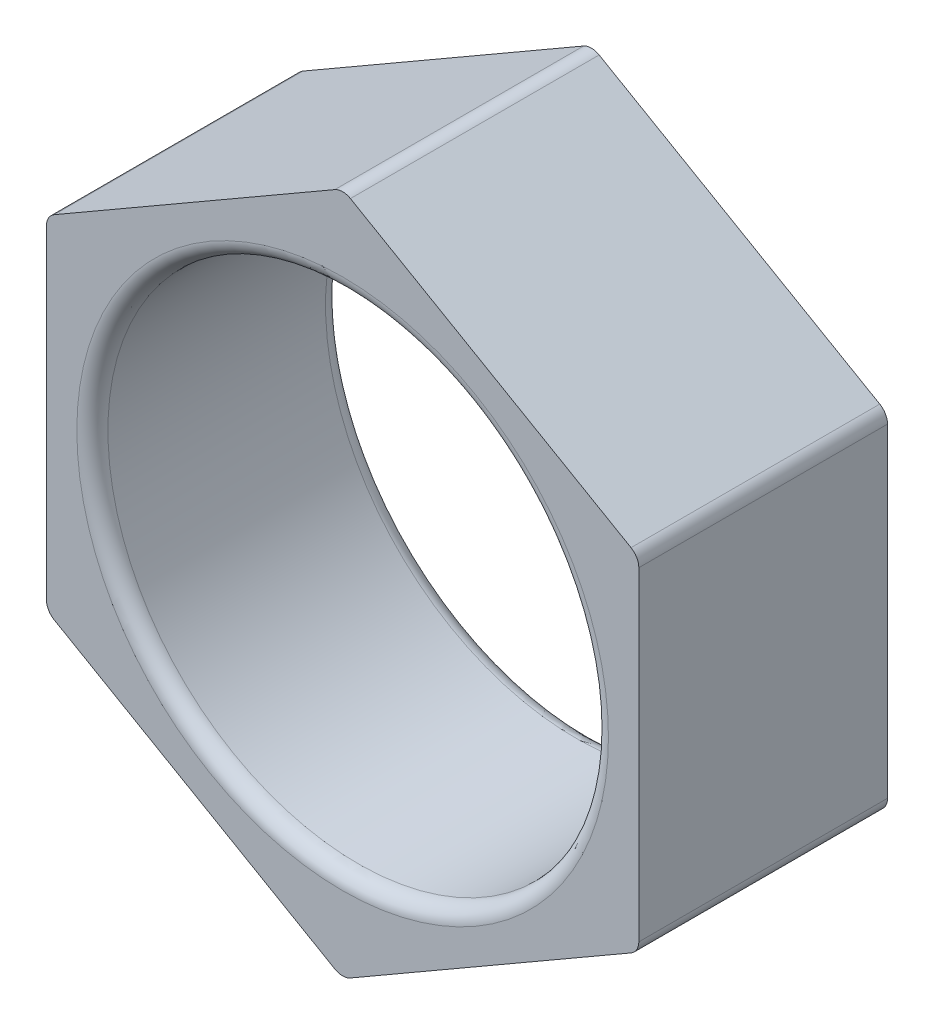
from build123d import *

# Parameters (mm, degrees)
BOSS_EXTRUDE1_DEPTH = 4
SKETCH2_R           = 4.025
CUT_EXTRUDE1_DEPTH  = 9.302860953
FILLET1_R           = 0.25


with BuildPart() as part:
    # Sketch1 → Boss-Extrude1 (new body)
    with BuildSketch(Plane.XY):
        Polygon((0, 5.5), (-4.763139721, 2.75), (-4.763139721, -2.75), (0, -5.5), (4.763139721, -2.75), (4.763139721, 2.75), align=None)
    extrude(amount=BOSS_EXTRUDE1_DEPTH)

    # Sketch2 → Cut-Extrude1 (cut, through all)
    with BuildSketch(Plane.XY.offset(4)):
        Circle(SKETCH2_R)
    extrude(amount=-CUT_EXTRUDE1_DEPTH, mode=Mode.SUBTRACT)

    # Fillet1
    fillet1_edges = [part.edges().sort_by_distance(p)[0] for p in [
        (-4.025, 0, 4),
        (-4.025, 0, 0),
        (-4.763139721, 2.75, 2),
        (-4.763139721, -2.75, 2),
        (0, -5.5, 2),
        (4.763139721, -2.75, 2),
        (4.763139721, 2.75, 2),
        (0, 5.5, 2),
    ]]
    fillet(fillet1_edges, radius=FILLET1_R)


solid = part.part
